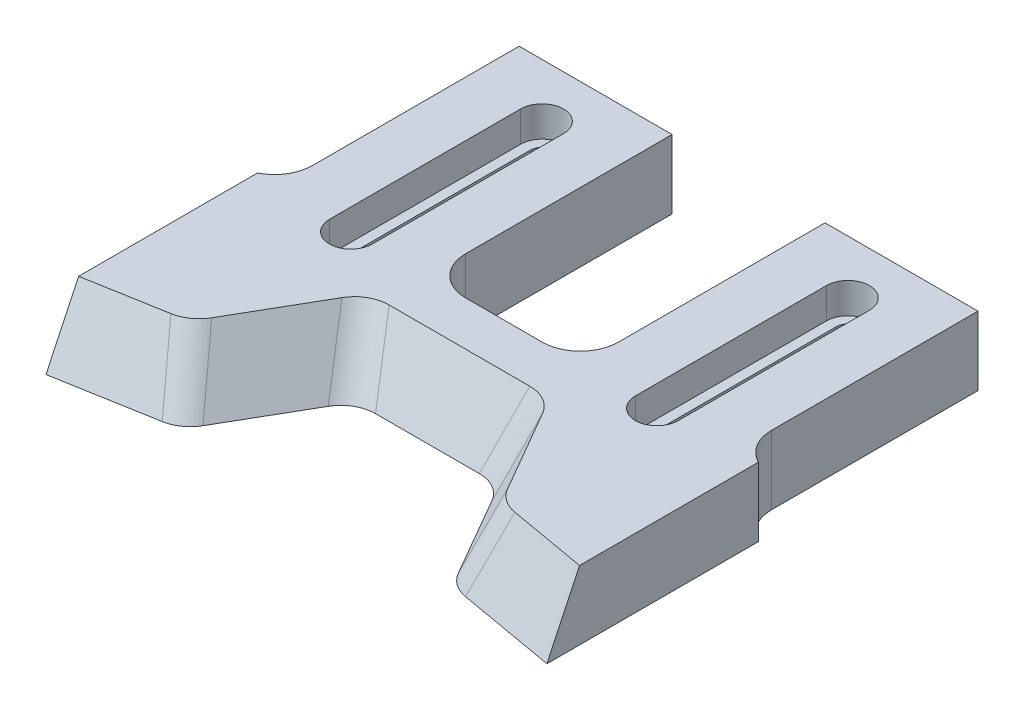
from build123d import *

# Parameters (mm, degrees)
BOSS_EXTRUDE1_DEPTH = 9
CUT_EXTRUDE2_REACH  = 98.857
SKETCH5_W           = 20
SKETCH5_H           = 32
SKETCH5_W_2         = 7.75
CUT_EXTRUDE3_DEPTH  = 10
FILLET1_R           = 5
CUT_EXTRUDE4_DEPTH  = 4
FILLET2_R           = 5
CUT_EXTRUDE5_REACH  = 98.857
SKETCH7_W           = 5
SKETCH7_H           = 33.085129134
SKETCH7_H_2         = 33.745309592


with BuildPart() as part:
    # Sketch1 → Boss-Extrude1 (new body)
    with BuildSketch(Plane(origin=(0, 0, 0), x_dir=(1, 0, 0), z_dir=(0, 1, 0))):
        Polygon((0, 0), (0, 60), (75.5, 60), (75.5, 0), (55.5, 3.526539614), (47.14374375, 18), (28.35625625, 18), (20, 3.526539614), align=None)
    extrude(amount=BOSS_EXTRUDE1_DEPTH)

    # Sketch4 → Cut-Extrude2 (cut, up to next)
    with BuildSketch(Plane(origin=(0, 9, 0), x_dir=(1, 0, 0), z_dir=(0, 1, 0)), mode=Mode.PRIVATE) as cut_extrude2_sk1:
        with BuildLine():
            Line((19.25, 53), (19.25, 28))
            ThreePointArc((19.25, 28), (17.75, 26.5), (16.25, 28))
            Line((16.25, 28), (16.25, 53))
            ThreePointArc((16.25, 53), (17.75, 54.5), (19.25, 53))
        make_face()
    cut_extrude2_tool1 = extrude(cut_extrude2_sk1.sketch, amount=-CUT_EXTRUDE2_REACH, mode=Mode.PRIVATE) & part.part
    # Sketch4 → Cut-Extrude2 (cut, up to next)
    with BuildSketch(Plane(origin=(0, 9, 0), x_dir=(1, 0, 0), z_dir=(0, 1, 0)), mode=Mode.PRIVATE) as cut_extrude2_sk2:
        with BuildLine():
            Line((59.25, 53), (59.25, 28))
            ThreePointArc((59.25, 28), (57.75, 26.5), (56.25, 28))
            Line((56.25, 28), (56.25, 53))
            ThreePointArc((56.25, 53), (57.75, 54.5), (59.25, 53))
        make_face()
    cut_extrude2_tool2 = extrude(cut_extrude2_sk2.sketch, amount=-CUT_EXTRUDE2_REACH, mode=Mode.PRIVATE) & part.part
    add(cut_extrude2_tool1.solids().sort_by_distance((17.75, 9, -40.5))[0], mode=Mode.SUBTRACT)
    add(cut_extrude2_tool2.solids().sort_by_distance((57.75, 9, -40.5))[0], mode=Mode.SUBTRACT)

    # Sketch5 → Cut-Extrude3 (cut)
    with BuildSketch(Plane(origin=(0, 9, 0), x_dir=(1, 0, 0), z_dir=(0, 1, 0))):
        with Locations((37.75, 44)):
            Rectangle(SKETCH5_W, SKETCH5_H)
        with Locations((71.625, 44)):
            Rectangle(SKETCH5_W_2, SKETCH5_H)
        with Locations((3.875, 44)):
            Rectangle(SKETCH5_W_2, SKETCH5_H)
    extrude(amount=-CUT_EXTRUDE3_DEPTH, mode=Mode.SUBTRACT)

    # Fillet1
    fillet1_edges = [part.edges().sort_by_distance(p)[0] for p in [
        (27.75, 4.5, -28),
        (47.75, 4.5, -28),
        (7.75, 4.5, -28),
        (67.75, 4.5, -28),
    ]]
    fillet(fillet1_edges, radius=FILLET1_R)

    # Sketch6 → Cut-Extrude4 (cut)
    with BuildSketch(Plane(origin=(0, 9, 0), x_dir=(1, 0, 0), z_dir=(0, 1, 0))):
        with BuildLine():
            Line((20.55, 53), (20.55, 28))
            ThreePointArc((20.55, 28), (17.75, 25.2), (14.95, 28))
            Line((14.95, 28), (14.95, 53))
            ThreePointArc((14.95, 53), (17.75, 55.8), (20.55, 53))
        make_face()
        with BuildLine():
            Line((60.55, 53), (60.55, 28))
            ThreePointArc((60.55, 28), (57.75, 25.2), (54.95, 28))
            Line((54.95, 28), (54.95, 53))
            ThreePointArc((54.95, 53), (57.75, 55.8), (60.55, 53))
        make_face()
    extrude(amount=-CUT_EXTRUDE4_DEPTH, mode=Mode.SUBTRACT)

    # Chamfer1
    # the kernel refuses this chamfer: 9, 4.196768923 mm, written as the material it takes off along each edge
    with BuildSketch(Plane(origin=(98.464514589, 9, 4.049263521), x_dir=(-0.002832403926993569, -0.9998669641130703, 0.016063360896972027), z_dir=(-0.9848077530122074, 0, -0.17364817766693463))) as chamfer1_piece_1_section:
        with BuildLine():
            Line((9.327511697, 0), (-0.397163207, -4.34301108))
            Line((-0.397163207, -4.34301108), (-0.57713926, -4.34007507))
            ThreePointArc((-0.57713926, -4.34007507), (-0.215443958, -2.171230459), (-0.179976054, 0.00293601))
            Line((-0.179976054, 0.00293601), (0.00293601, 0.179976054))
            ThreePointArc((0.00293601, 0.179976054), (4.665451047, 0.103914887), (9.330447707, 0.179976054))
            Line((9.330447707, 0.179976054), (9.327511697, 0))
        make_face()
    chamfer1_piece_1 = extrude(amount=66.946090723, mode=Mode.PRIVATE)
    chamfer1_piece_1 = split(chamfer1_piece_1, bisect_by=Plane(origin=(75.5, 5.998922667, -3.223017073), z_dir=(-1, 0, 0)), keep=Keep.TOP, mode=Mode.PRIVATE)
    chamfer1_piece_1 = split(chamfer1_piece_1, bisect_by=Plane(origin=(58.020430992, 5.998922667, 0.83897492), z_dir=(0.8660254037844379, 0, -0.5000000000000017)), keep=Keep.TOP, mode=Mode.PRIVATE)
    add(chamfer1_piece_1, mode=Mode.SUBTRACT)
    with BuildSketch(Plane(origin=(42.964514589, 9, -7.575803135), x_dir=(0.002832403926993593, -0.9998669641130703, 0.01606336089697216), z_dir=(-0.9848077530122074, 0, 0.1736481776669347))) as chamfer1_piece_2_section:
        with BuildLine():
            Line((9.327511697, 0), (-0.397163207, -4.34301108))
            Line((-0.397163207, -4.34301108), (-0.57713926, -4.34007507))
            ThreePointArc((-0.57713926, -4.34007507), (-0.215443958, -2.171230459), (-0.179976054, 0.00293601))
            Line((-0.179976054, 0.00293601), (0.00293601, 0.179976054))
            ThreePointArc((0.00293601, 0.179976054), (4.665451047, 0.103914887), (9.330447707, 0.179976054))
            Line((9.330447707, 0.179976054), (9.327511697, 0))
        make_face()
    chamfer1_piece_2 = extrude(amount=66.946090723, mode=Mode.PRIVATE)
    chamfer1_piece_2 = split(chamfer1_piece_2, bisect_by=Plane(origin=(17.479569008, 5.998922667, 0.83897492), z_dir=(-0.8660254037844382, 0, -0.500000000000001)), keep=Keep.TOP, mode=Mode.PRIVATE)
    chamfer1_piece_2 = split(chamfer1_piece_2, bisect_by=Plane(origin=(0, 5.998922667, -3.223017073), z_dir=(1, 0, 0)), keep=Keep.TOP, mode=Mode.PRIVATE)
    add(chamfer1_piece_2, mode=Mode.SUBTRACT)
    with BuildSketch(Plane(origin=(67.159389621, 9, 16.668115595), x_dir=(-0.014125882502839455, -0.9998669641130703, 0.008155582065555418), z_dir=(-0.5000000000000017, 0, -0.8660254037844378))) as chamfer1_piece_3_section:
        with BuildLine():
            Line((9.327511697, 0), (-0.397163207, -4.34301108))
            Line((-0.397163207, -4.34301108), (-0.57713926, -4.34007507))
            ThreePointArc((-0.57713926, -4.34007507), (-0.215443958, -2.171230459), (-0.179976054, 0.00293601))
            Line((-0.179976054, 0.00293601), (0.00293601, 0.179976054))
            ThreePointArc((0.00293601, 0.179976054), (4.665451047, 0.103914887), (9.330447707, 0.179976054))
            Line((9.330447707, 0.179976054), (9.327511697, 0))
        make_face()
    chamfer1_piece_3 = extrude(amount=63.350070985, mode=Mode.PRIVATE)
    chamfer1_piece_3 = split(chamfer1_piece_3, bisect_by=Plane(origin=(51.823877601, 5.976991007, -4.174739178), z_dir=(0.17364817766693463, 0, -0.9848077530122074)), keep=Keep.TOP, mode=Mode.PRIVATE)
    chamfer1_piece_3 = split(chamfer1_piece_3, bisect_by=Plane(origin=(52.958801504, 5.976991007, -18), z_dir=(0, 0, 1)), keep=Keep.TOP, mode=Mode.PRIVATE)
    add(chamfer1_piece_3, mode=Mode.SUBTRACT)
    with BuildSketch(Plane(origin=(70.462522993, 9, -18), x_dir=(0, -0.9998669641130703, 0.01631116413111029), z_dir=(-1, 0, 0))) as chamfer1_piece_4_section:
        with BuildLine():
            Line((9.327511697, 0), (-0.397163207, -4.34301108))
            Line((-0.397163207, -4.34301108), (-0.57713926, -4.34007507))
            ThreePointArc((-0.57713926, -4.34007507), (-0.215443958, -2.171230459), (-0.179976054, 0.00293601))
            Line((-0.179976054, 0.00293601), (0.00293601, 0.179976054))
            ThreePointArc((0.00293601, 0.179976054), (4.665451047, 0.103914887), (9.330447707, 0.179976054))
            Line((9.330447707, 0.179976054), (9.327511697, 0))
        make_face()
    chamfer1_piece_4 = extrude(amount=65.425045986, mode=Mode.PRIVATE)
    chamfer1_piece_4 = split(chamfer1_piece_4, bisect_by=Plane(origin=(44.256558159, 5.863829833, -23.000752134), z_dir=(-0.8660254037844379, 0, 0.5000000000000017)), keep=Keep.TOP, mode=Mode.PRIVATE)
    chamfer1_piece_4 = split(chamfer1_piece_4, bisect_by=Plane(origin=(31.243441841, 5.863829833, -23.000752134), z_dir=(0.8660254037844382, 0, 0.500000000000001)), keep=Keep.TOP, mode=Mode.PRIVATE)
    add(chamfer1_piece_4, mode=Mode.SUBTRACT)
    with BuildSketch(Plane(origin=(40.015645871, 9, -38.19465521), x_dir=(0.014125882502839221, -0.9998669641130703, 0.00815558206555527), z_dir=(-0.5000000000000009, 0, 0.866025403784438))) as chamfer1_piece_5_section:
        with BuildLine():
            Line((9.327511697, 0), (-0.397163207, -4.34301108))
            Line((-0.397163207, -4.34301108), (-0.57713926, -4.34007507))
            ThreePointArc((-0.57713926, -4.34007507), (-0.215443958, -2.171230459), (-0.179976054, 0.00293601))
            Line((-0.179976054, 0.00293601), (0.00293601, 0.179976054))
            ThreePointArc((0.00293601, 0.179976054), (4.665451047, 0.103914887), (9.330447707, 0.179976054))
            Line((9.330447707, 0.179976054), (9.327511697, 0))
        make_face()
    chamfer1_piece_5 = extrude(amount=63.350070985, mode=Mode.PRIVATE)
    chamfer1_piece_5 = split(chamfer1_piece_5, bisect_by=Plane(origin=(22.541198496, 5.976991007, -18), z_dir=(0, 0, 1)), keep=Keep.TOP, mode=Mode.PRIVATE)
    chamfer1_piece_5 = split(chamfer1_piece_5, bisect_by=Plane(origin=(23.676122399, 5.976991007, -4.174739178), z_dir=(-0.1736481776669347, 0, -0.9848077530122074)), keep=Keep.TOP, mode=Mode.PRIVATE)
    add(chamfer1_piece_5, mode=Mode.SUBTRACT)
    with BuildSketch(Plane(origin=(98.464514589, 9, 4.049263521), x_dir=(-0.002832403926993569, -0.9998669641130703, 0.016063360896972027), z_dir=(-0.9848077530122074, 0, -0.17364817766693463))) as chamfer1_piece_6a_section:
        with BuildLine():
            Line((9.327511697, 0), (-0.397163207, -4.34301108))
            Line((-0.397163207, -4.34301108), (-0.57713926, -4.34007507))
            ThreePointArc((-0.57713926, -4.34007507), (-0.215443958, -2.171230459), (-0.179976054, 0.00293601))
            Line((-0.179976054, 0.00293601), (0.00293601, 0.179976054))
            ThreePointArc((0.00293601, 0.179976054), (4.665451047, 0.103914887), (9.330447707, 0.179976054))
            Line((9.330447707, 0.179976054), (9.327511697, 0))
        make_face()
    chamfer1_piece_6a = extrude(amount=66.946090723, mode=Mode.PRIVATE)
    chamfer1_piece_6a = split(chamfer1_piece_6a, bisect_by=Plane(origin=(51.090565692, 5.903894994, -11.163903869), z_dir=(-0.8660254037844379, 0, 0.5000000000000017)), keep=Keep.TOP, mode=Mode.PRIVATE)
    with BuildSketch(Plane(origin=(67.159389621, 9, 16.668115595), x_dir=(-0.014125882502839455, -0.9998669641130703, 0.008155582065555418), z_dir=(-0.5000000000000017, 0, -0.8660254037844378))) as chamfer1_piece_6b_section:
        with BuildLine():
            Line((9.327511697, 0), (-0.397163207, -4.34301108))
            Line((-0.397163207, -4.34301108), (-0.57713926, -4.34007507))
            ThreePointArc((-0.57713926, -4.34007507), (-0.215443958, -2.171230459), (-0.179976054, 0.00293601))
            Line((-0.179976054, 0.00293601), (0.00293601, 0.179976054))
            ThreePointArc((0.00293601, 0.179976054), (4.665451047, 0.103914887), (9.330447707, 0.179976054))
            Line((9.330447707, 0.179976054), (9.327511697, 0))
        make_face()
    chamfer1_piece_6b = extrude(amount=63.350070985, mode=Mode.PRIVATE)
    chamfer1_piece_6b = split(chamfer1_piece_6b, bisect_by=Plane(origin=(64.184890186, 5.903894994, -1.99515915), z_dir=(-0.17364817766693463, 0, 0.9848077530122074)), keep=Keep.TOP, mode=Mode.PRIVATE)
    chamfer1_piece_6 = chamfer1_piece_6a & chamfer1_piece_6b
    add(chamfer1_piece_6, mode=Mode.SUBTRACT)
    with BuildSketch(Plane(origin=(40.015645871, 9, -38.19465521), x_dir=(0.014125882502839221, -0.9998669641130703, 0.00815558206555527), z_dir=(-0.5000000000000009, 0, 0.866025403784438))) as chamfer1_piece_7a_section:
        with BuildLine():
            Line((9.327511697, 0), (-0.397163207, -4.34301108))
            Line((-0.397163207, -4.34301108), (-0.57713926, -4.34007507))
            ThreePointArc((-0.57713926, -4.34007507), (-0.215443958, -2.171230459), (-0.179976054, 0.00293601))
            Line((-0.179976054, 0.00293601), (0.00293601, 0.179976054))
            ThreePointArc((0.00293601, 0.179976054), (4.665451047, 0.103914887), (9.330447707, 0.179976054))
            Line((9.330447707, 0.179976054), (9.327511697, 0))
        make_face()
    chamfer1_piece_7a = extrude(amount=63.350070985, mode=Mode.PRIVATE)
    chamfer1_piece_7a = split(chamfer1_piece_7a, bisect_by=Plane(origin=(11.315109814, 5.903894994, -1.99515915), z_dir=(0.1736481776669347, 0, 0.9848077530122074)), keep=Keep.TOP, mode=Mode.PRIVATE)
    with BuildSketch(Plane(origin=(42.964514589, 9, -7.575803135), x_dir=(0.002832403926993593, -0.9998669641130703, 0.01606336089697216), z_dir=(-0.9848077530122074, 0, 0.1736481776669347))) as chamfer1_piece_7b_section:
        with BuildLine():
            Line((9.327511697, 0), (-0.397163207, -4.34301108))
            Line((-0.397163207, -4.34301108), (-0.57713926, -4.34007507))
            ThreePointArc((-0.57713926, -4.34007507), (-0.215443958, -2.171230459), (-0.179976054, 0.00293601))
            Line((-0.179976054, 0.00293601), (0.00293601, 0.179976054))
            ThreePointArc((0.00293601, 0.179976054), (4.665451047, 0.103914887), (9.330447707, 0.179976054))
            Line((9.330447707, 0.179976054), (9.327511697, 0))
        make_face()
    chamfer1_piece_7b = extrude(amount=66.946090723, mode=Mode.PRIVATE)
    chamfer1_piece_7b = split(chamfer1_piece_7b, bisect_by=Plane(origin=(24.409434308, 5.903894994, -11.163903869), z_dir=(0.8660254037844382, 0, 0.500000000000001)), keep=Keep.TOP, mode=Mode.PRIVATE)
    chamfer1_piece_7 = chamfer1_piece_7a & chamfer1_piece_7b
    add(chamfer1_piece_7, mode=Mode.SUBTRACT)
    with BuildSketch(Plane(origin=(67.159389621, 9, 16.668115595), x_dir=(-0.014125882502839455, -0.9998669641130703, 0.008155582065555418), z_dir=(-0.5000000000000017, 0, -0.8660254037844378))) as chamfer1_piece_8a_section:
        with BuildLine():
            Line((9.327511697, 0), (-0.397163207, -4.34301108))
            Line((-0.397163207, -4.34301108), (-0.57713926, -4.34007507))
            ThreePointArc((-0.57713926, -4.34007507), (-0.215443958, -2.171230459), (-0.179976054, 0.00293601))
            Line((-0.179976054, 0.00293601), (0.00293601, 0.179976054))
            ThreePointArc((0.00293601, 0.179976054), (4.665451047, 0.103914887), (9.330447707, 0.179976054))
            Line((9.330447707, 0.179976054), (9.327511697, 0))
        make_face()
    chamfer1_piece_8a = extrude(amount=63.350070985, mode=Mode.PRIVATE)
    chamfer1_piece_8a = split(chamfer1_piece_8a, bisect_by=Plane(origin=(42.679871827, 5.988864312, -18), z_dir=(0, 0, -1)), keep=Keep.TOP, mode=Mode.PRIVATE)
    with BuildSketch(Plane(origin=(70.462522993, 9, -18), x_dir=(0, -0.9998669641130703, 0.01631116413111029), z_dir=(-1, 0, 0))) as chamfer1_piece_8b_section:
        with BuildLine():
            Line((9.327511697, 0), (-0.397163207, -4.34301108))
            Line((-0.397163207, -4.34301108), (-0.57713926, -4.34007507))
            ThreePointArc((-0.57713926, -4.34007507), (-0.215443958, -2.171230459), (-0.179976054, 0.00293601))
            Line((-0.179976054, 0.00293601), (0.00293601, 0.179976054))
            ThreePointArc((0.00293601, 0.179976054), (4.665451047, 0.103914887), (9.330447707, 0.179976054))
            Line((9.330447707, 0.179976054), (9.327511697, 0))
        make_face()
    chamfer1_piece_8b = extrude(amount=65.425045986, mode=Mode.PRIVATE)
    chamfer1_piece_8b = split(chamfer1_piece_8b, bisect_by=Plane(origin=(49.375679712, 5.988864312, -14.134173515), z_dir=(0.8660254037844379, 0, -0.5000000000000017)), keep=Keep.TOP, mode=Mode.PRIVATE)
    chamfer1_piece_8 = chamfer1_piece_8a & chamfer1_piece_8b
    add(chamfer1_piece_8, mode=Mode.SUBTRACT)
    with BuildSketch(Plane(origin=(70.462522993, 9, -18), x_dir=(0, -0.9998669641130703, 0.01631116413111029), z_dir=(-1, 0, 0))) as chamfer1_piece_9a_section:
        with BuildLine():
            Line((9.327511697, 0), (-0.397163207, -4.34301108))
            Line((-0.397163207, -4.34301108), (-0.57713926, -4.34007507))
            ThreePointArc((-0.57713926, -4.34007507), (-0.215443958, -2.171230459), (-0.179976054, 0.00293601))
            Line((-0.179976054, 0.00293601), (0.00293601, 0.179976054))
            ThreePointArc((0.00293601, 0.179976054), (4.665451047, 0.103914887), (9.330447707, 0.179976054))
            Line((9.330447707, 0.179976054), (9.327511697, 0))
        make_face()
    chamfer1_piece_9a = extrude(amount=65.425045986, mode=Mode.PRIVATE)
    chamfer1_piece_9a = split(chamfer1_piece_9a, bisect_by=Plane(origin=(26.124320288, 5.988864312, -14.134173515), z_dir=(-0.8660254037844382, 0, -0.500000000000001)), keep=Keep.TOP, mode=Mode.PRIVATE)
    with BuildSketch(Plane(origin=(40.015645871, 9, -38.19465521), x_dir=(0.014125882502839221, -0.9998669641130703, 0.00815558206555527), z_dir=(-0.5000000000000009, 0, 0.866025403784438))) as chamfer1_piece_9b_section:
        with BuildLine():
            Line((9.327511697, 0), (-0.397163207, -4.34301108))
            Line((-0.397163207, -4.34301108), (-0.57713926, -4.34007507))
            ThreePointArc((-0.57713926, -4.34007507), (-0.215443958, -2.171230459), (-0.179976054, 0.00293601))
            Line((-0.179976054, 0.00293601), (0.00293601, 0.179976054))
            ThreePointArc((0.00293601, 0.179976054), (4.665451047, 0.103914887), (9.330447707, 0.179976054))
            Line((9.330447707, 0.179976054), (9.327511697, 0))
        make_face()
    chamfer1_piece_9b = extrude(amount=63.350070985, mode=Mode.PRIVATE)
    chamfer1_piece_9b = split(chamfer1_piece_9b, bisect_by=Plane(origin=(32.820128173, 5.988864312, -18), z_dir=(0, 0, -1)), keep=Keep.TOP, mode=Mode.PRIVATE)
    chamfer1_piece_9 = chamfer1_piece_9a & chamfer1_piece_9b
    add(chamfer1_piece_9, mode=Mode.SUBTRACT)

    # Fillet2
    fillet2_edges = [part.edges().sort_by_distance(p)[0] for p in [
        (18.671992121, 4.5, -5.423131419),
        (27.144753416, 4.5, -20.098384462),
        (48.355246584, 4.5, -20.098384462),
        (56.828007879, 4.5, -5.423131419),
    ]]
    fillet(fillet2_edges, radius=FILLET2_R)

    # Sketch7 → Cut-Extrude5 (cut, up to next)
    with BuildSketch(Plane(origin=(0, 9, 0), x_dir=(1, 0, 0), z_dir=(0, 1, 0)), mode=Mode.PRIVATE) as cut_extrude5_sk1:
        with Locations((2.5, 16.542564567)):
            Rectangle(SKETCH7_W, SKETCH7_H)
    cut_extrude5_tool1 = extrude(cut_extrude5_sk1.sketch, amount=-CUT_EXTRUDE5_REACH, mode=Mode.PRIVATE) & part.part
    # Sketch7 → Cut-Extrude5 (cut, up to next)
    with BuildSketch(Plane(origin=(0, 9, 0), x_dir=(1, 0, 0), z_dir=(0, 1, 0)), mode=Mode.PRIVATE) as cut_extrude5_sk2:
        with Locations((73, 16.872654796)):
            Rectangle(SKETCH7_W, SKETCH7_H_2)
    cut_extrude5_tool2 = extrude(cut_extrude5_sk2.sketch, amount=-CUT_EXTRUDE5_REACH, mode=Mode.PRIVATE) & part.part
    add(cut_extrude5_tool1.solids().sort_by_distance((2.5, 9, -16.542565))[0], mode=Mode.SUBTRACT)
    add(cut_extrude5_tool2.solids().sort_by_distance((73, 9, -16.872655))[0], mode=Mode.SUBTRACT)


solid = part.part
